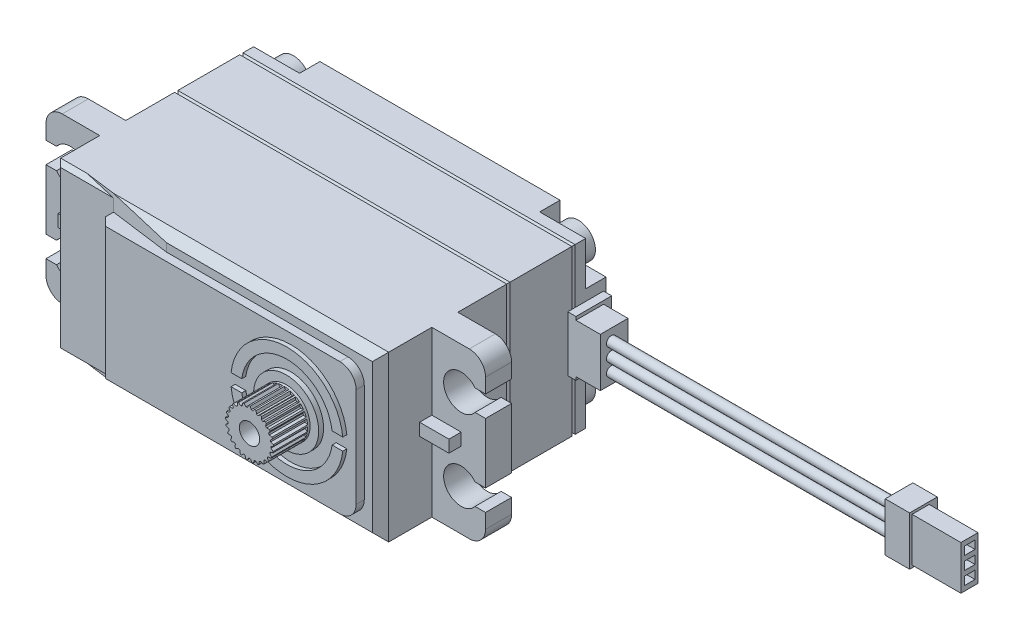
from build123d import *

# Parameters (mm, degrees)
SKETCH_1_W          = 40.8
SKETCH_1_H          = 20.2
EXTRUDE_1_DEPTH     = 4
CHAMFER_1_SIZE      = 0.2
SKETCH_2_W          = 40.8
SKETCH_2_H          = 20.2
EXTRUDE_2_DEPTH     = 8
CHAMFER_5_SIZE      = 0.2
SKETCH_3_W          = 40.8
SKETCH_3_H          = 20.2
EXTRUDE_3_DEPTH     = 15.7
CHAMFER_6_SIZE      = 0.2
CHAMFER_3_SIZE      = 1
CHAMFER_4_SIZE      = 0.2
SKETCH_4_R          = 6.9
EXTRUDE_4_DEPTH     = 1.5
SKETCH_5_R          = 4
EXTRUDE_5_DEPTH     = 0.1
SKETCH_6_R          = 2.95
EXTRUDE_6_DEPTH     = 4.5
SKETCH_7_R          = 1.25
CUT_EXTRUDE_1_DEPTH = 5
CUT_EXTRUDE_2_DEPTH = 4.2
EXTRUDE_7_DEPTH     = 3.2
FILLET_1_R          = 2
SKETCH_10_W         = 36.8
SKETCH_10_H         = 16.2
SKETCH_10_R         = 6.9
EXTRUDE_8_DEPTH     = 1
SKETCH_11_W         = 5
SKETCH_11_H         = 16.2
CUT_EXTRUDE_3_DEPTH = 1
FILLET_2_R          = 2
SKETCH_12_W         = 4.4
SKETCH_12_H         = 6.8
EXTRUDE_9_DEPTH     = 1
SKETCH_13_W         = 3.4
SKETCH_13_H         = 6
EXTRUDE_10_DEPTH    = 3
SKETCH_14_R         = 0.6
EXTRUDE_11_DEPTH    = 35
SKETCH_15_W         = 3.4
SKETCH_15_H         = 6
EXTRUDE_12_DEPTH    = 3
SKETCH_16_W         = 2.1
SKETCH_16_H         = 5.4
SKETCH_16_W_2       = 1.300246416
SKETCH_16_H_2       = 1
EXTRUDE_13_DEPTH    = 6
SKETCH_17_R         = 1
CUT_EXTRUDE_4_DEPTH = 2.5
SKETCH_18_R         = 1
CUT_EXTRUDE_5_DEPTH = 2.5
SKETCH_19_R         = 2.1
EXTRUDE_14_DEPTH    = 2
SKETCH_20_W         = 3.6
SKETCH_20_H         = 1.5
EXTRUDE_15_DEPTH    = 1.5
SKETCH_21_R         = 5.6
SKETCH_21_R_2       = 4
CUT_EXTRUDE_6_DEPTH = 0.5
CUT_EXTRUDE_7_DEPTH = 0.5
SKETCH_23_W         = 7
SKETCH_23_H         = 20.2
CUT_EXTRUDE_8_DEPTH = 1
CUT_EXTRUDE_9_DEPTH = 2
CHAMFER_7_SIZE      = 1
CHAMFER_9_SIZE      = 0.5


with BuildPart() as part:
    # 草图1 → 凸台-拉伸1 (new body)
    with BuildSketch(Plane.XY):
        Rectangle(SKETCH_1_W, SKETCH_1_H)
    extrude(amount=EXTRUDE_1_DEPTH)

    # 倒角1
    chamfer_1_edges = [part.edges().sort_by_distance(p)[0] for p in [
        (0, -10.1, 4),
        (20.4, 0, 4),
        (-20.4, 0, 4),
        (0, 10.1, 4),
    ]]
    chamfer(chamfer_1_edges, length=CHAMFER_1_SIZE)



with BuildPart() as body_2:
    # 草图2 → 凸台-拉伸2 (new body)
    with BuildSketch(Plane.XY.offset(4)):
        Rectangle(SKETCH_2_W, SKETCH_2_H)
    extrude(amount=EXTRUDE_2_DEPTH)

    # 倒角5
    chamfer_5_edges = [body_2.edges().sort_by_distance(p)[0] for p in [
        (0, -10.1, 12),
        (20.4, 0, 12),
        (-20.4, 0, 12),
        (0, 10.1, 12),
    ]]
    chamfer(chamfer_5_edges, length=CHAMFER_5_SIZE)

    # 倒角4
    chamfer_4_edges = [body_2.edges().sort_by_distance(p)[0] for p in [
        (0, 10.1, 4),
        (20.4, 0, 4),
        (0, -10.1, 4),
        (-20.4, 0, 4),
    ]]
    chamfer(chamfer_4_edges, length=CHAMFER_4_SIZE)


with BuildPart() as body_3:
    # 草图3 → 凸台-拉伸3 (new body)
    with BuildSketch(Plane.XY.offset(12)):
        Rectangle(SKETCH_3_W, SKETCH_3_H)
    extrude(amount=EXTRUDE_3_DEPTH)

    # 倒角6
    chamfer_6_edges = [body_3.edges().sort_by_distance(p)[0] for p in [
        (0, 10.1, 12),
        (20.4, 0, 12),
        (-20.4, 0, 12),
        (0, -10.1, 12),
    ]]
    chamfer(chamfer_6_edges, length=CHAMFER_6_SIZE)

    # 倒角3
    chamfer_3_edges = [body_3.edges().sort_by_distance(p)[0] for p in [
        (20.4, 0, 27.7),
        (0, -10.1, 27.7),
        (-20.4, 0, 27.7),
        (0, 10.1, 27.7),
    ]]
    chamfer(chamfer_3_edges, length=CHAMFER_3_SIZE)

    # 草图4 → 凸台-拉伸4 (add)
    with BuildSketch(Plane.XY.offset(27.7)):
        with Locations((10.4, 0)):
            Circle(SKETCH_4_R)
    extrude(amount=EXTRUDE_4_DEPTH)

    # 草图5 → 凸台-拉伸5 (add)
    with BuildSketch(Plane.XY.offset(29.2)):
        with Locations((10.4, 0)):
            Circle(SKETCH_5_R)
    extrude(amount=EXTRUDE_5_DEPTH)

    # 草图6 → 凸台-拉伸6 (add)
    with BuildSketch(Plane.XY.offset(29.3)):
        with Locations((10.4, 0)):
            Circle(SKETCH_6_R)
    extrude(amount=EXTRUDE_6_DEPTH)

    # 草图7 → 切除-拉伸1 (cut)
    with BuildSketch(Plane.XY.offset(33.8)):
        with Locations((10.4, 0)):
            Circle(SKETCH_7_R)
    extrude(amount=-CUT_EXTRUDE_1_DEPTH, mode=Mode.SUBTRACT)

    # 草图8 → 切除-拉伸2 (cut)
    with BuildSketch(Plane.XY.offset(33.8)):
        with BuildLine():
            Line((11.036355222, 2.880547176), (10.812882687, 2.613339954))
            ThreePointArc((10.812882687, 2.613339954), (10.718629565, 2.62690868), (10.623963172, 2.637206039))
            Line((10.623963172, 2.637206039), (10.475180758, 2.949041853))
            ThreePointArc((10.475180758, 2.949041853), (10.757412567, 2.928268474), (11.036355222, 2.880547176))
        make_face()
        with BuildLine():
            Line((10.3, 2.948304598), (10.15, 2.633916823))
            ThreePointArc((10.15, 2.633916823), (10.055333608, 2.623619464), (9.961080485, 2.610050738))
            Line((9.961080485, 2.610050738), (9.739421931, 2.875088975))
            ThreePointArc((9.739421931, 2.875088975), (10.017953037, 2.925156426), (10.3, 2.948304598))
        make_face()
        with BuildLine():
            Line((11.732725904, 2.631794381), (11.449822437, 2.428557325))
            ThreePointArc((11.449822437, 2.428557325), (11.361904854, 2.465139563), (11.27277343, 2.498655986))
            Line((11.27277343, 2.498655986), (11.206215702, 2.837695587))
            ThreePointArc((11.206215702, 2.837695587), (11.47441455, 2.747386645), (11.732725904, 2.631794381))
        make_face()
        with BuildLine():
            Line((12.345356517, 2.217676266), (12.020797982, 2.091179508))
            ThreePointArc((12.020797982, 2.091179508), (11.944740124, 2.148476661), (11.866744123, 2.203106188))
            Line((11.866744123, 2.203106188), (11.886593149, 2.54804647))
            ThreePointArc((11.886593149, 2.54804647), (12.123907116, 2.393876408), (12.345356517, 2.217676266))
        make_face()
        with BuildLine():
            Line((12.835753225, 1.664213396), (12.489932828, 1.622405191))
            ThreePointArc((12.489932828, 1.622405191), (12.430513691, 1.696817069), (12.368553888, 1.769127125))
            Line((12.368553888, 1.769127125), (12.47356248, 2.098294222))
            ThreePointArc((12.47356248, 2.098294222), (12.665080258, 1.889950112), (12.835753225, 1.664213396))
        make_face()
        with BuildLine():
            Line((13.1731026, 1.006181877), (12.827749509, 1.051689189))
            ThreePointArc((12.827749509, 1.051689189), (12.788702615, 1.13854022), (12.746672173, 1.223987299))
            Line((12.746672173, 1.223987299), (12.930242255, 1.516698431))
            ThreePointArc((12.930242255, 1.516698431), (13.063930076, 1.2672713), (13.1731026, 1.006181877))
        make_face()
        with BuildLine():
            Line((13.33620774, 0.28492825), (13.01302176, 0.414891688))
            ThreePointArc((13.01302176, 0.414891688), (12.996800569, 0.508724701), (12.977340415, 0.601939849))
            Line((12.977340415, 0.601939849), (13.227937603, 0.8398029))
            ThreePointArc((13.227937603, 0.8398029), (13.295395371, 0.564965172), (13.33620774, 0.28492825))
        make_face()
        with BuildLine():
            Line((13.314820149, -0.454228466), (13.034108243, -0.247974984))
            ThreePointArc((13.034108243, -0.247974984), (13.041731992, -0.153055861), (13.04606488, -0.057929695))
            Line((13.04606488, -0.057929695), (13.347943232, 0.110139464))
            ThreePointArc((13.347943232, 0.110139464), (13.344932326, -0.172839796), (13.314820149, -0.454228466))
        make_face()
        with BuildLine():
            Line((13.110283688, -1.164844338), (12.889684018, -0.895260476))
            ThreePointArc((12.889684018, -0.895260476), (12.920673679, -0.805219361), (12.948527356, -0.714159303))
            Line((12.948527356, -0.714159303), (13.282718745, -0.626444439))
            ThreePointArc((13.282718745, -0.626444439), (13.209428352, -0.899784604), (13.110283688, -1.164844338))
        make_face()
        with BuildLine():
            Line((12.735450135, -1.802268755), (12.58882379, -1.486293459))
            ThreePointArc((12.58882379, -1.486293459), (12.641232168, -1.406787967), (12.690856486, -1.325515656))
            Line((12.690856486, -1.325515656), (13.036362438, -1.323666535))
            ThreePointArc((13.036362438, -1.323666535), (12.897397663, -1.570192636), (12.735450135, -1.802268755))
        make_face()
        with BuildLine():
            Line((12.213871661, -2.326449999), (12.150431713, -1.983937159))
            ThreePointArc((12.150431713, -1.983937159), (12.220965797, -1.919962911), (12.289242678, -1.853584986))
            Line((12.289242678, -1.853584986), (12.624353783, -1.937717794))
            ThreePointArc((12.624353783, -1.937717794), (12.428446294, -2.14193969), (12.213871661, -2.326449999))
        make_face()
        with BuildLine():
            Line((11.57832096, -2.704451833), (11.602053574, -2.35692279))
            ThreePointArc((11.602053574, -2.35692279), (11.686281449, -2.312499524), (11.768920805, -2.265186753))
            Line((11.768920805, -2.265186753), (12.072580799, -2.430015117))
            ThreePointArc((12.072580799, -2.430015117), (11.832040183, -2.579100795), (11.57832096, -2.704451833))
        make_face()
        with BuildLine():
            Line((10.868732019, -2.912523012), (10.978145988, -2.581814294))
            ThreePointArc((10.978145988, -2.581814294), (11.070775306, -2.559733288), (11.162584602, -2.534458507))
            Line((11.162584602, -2.534458507), (11.415713412, -2.769625654))
            ThreePointArc((11.415713412, -2.769625654), (11.145653722, -2.854207513), (10.868732019, -2.912523012))
        make_face()
        with BuildLine():
            Line((10.129690921, -2.937589659), (10.317911363, -2.644480911))
            ThreePointArc((10.317911363, -2.644480911), (10.413121884, -2.646129595), (10.508332405, -2.644480911))
            Line((10.508332405, -2.644480911), (10.695025016, -2.935210425))
            ThreePointArc((10.695025016, -2.935210425), (10.412415095, -2.949973875), (10.129690921, -2.937589659))
        make_face()
        with BuildLine():
            Line((9.407634337, -2.778076743), (9.662834669, -2.540985066))
            ThreePointArc((9.662834669, -2.540985066), (9.754643965, -2.566259847), (9.847273284, -2.588340853))
            Line((9.847273284, -2.588340853), (9.955799113, -2.91636513))
            ThreePointArc((9.955799113, -2.91636513), (9.678396382, -2.86038253), (9.407634337, -2.778076743))
        make_face()
        with BuildLine():
            Line((8.747931738, -2.444007049), (9.054076784, -2.277829785))
            ThreePointArc((9.054076784, -2.277829785), (9.13671614, -2.325142556), (9.220944015, -2.369565821))
            Line((9.220944015, -2.369565821), (9.244483986, -2.714273888))
            ThreePointArc((9.244483986, -2.714273888), (8.989718678, -2.59106283), (8.747931738, -2.444007049))
        make_face()
        with BuildLine():
            Line((8.192034663, -1.956371404), (8.529888205, -1.871550081))
            ThreePointArc((8.529888205, -1.871550081), (8.598165086, -1.937928006), (8.66869917, -2.001902254))
            Line((8.66869917, -2.001902254), (8.605774179, -2.341634836))
            ThreePointArc((8.605774179, -2.341634836), (8.389654136, -2.158937124), (8.192034663, -1.956371404))
        make_face()
        with BuildLine():
            Line((7.77487217, -1.345809748), (8.123205627, -1.347674002))
            ThreePointArc((8.123205627, -1.347674002), (8.172829946, -1.428946313), (8.225238324, -1.508451805))
            Line((8.225238324, -1.508451805), (8.07980218, -1.821862254))
            ThreePointArc((8.07980218, -1.821862254), (7.915907018, -1.591157458), (7.77487217, -1.345809748))
        make_face()
        with BuildLine():
            Line((7.522656114, -0.650685916), (7.859582414, -0.73911861))
            ThreePointArc((7.859582414, -0.73911861), (7.887436091, -0.830178667), (7.918425752, -0.920219782))
            Line((7.918425752, -0.920219782), (7.699616742, -1.187615367))
            ThreePointArc((7.699616742, -1.187615367), (7.598244598, -0.923399517), (7.522656114, -0.650685916))
        make_face()
        with BuildLine():
            Line((7.451234156, 0.085322905), (7.75558298, -0.084121676))
            ThreePointArc((7.75558298, -0.084121676), (7.759915868, -0.179247843), (7.767539616, -0.274166966))
            Line((7.767539616, -0.274166966), (7.489106316, -0.478746239))
            ThreePointArc((7.489106316, -0.478746239), (7.456626774, -0.197620989), (7.451234156, 0.085322905))
        make_face()
        with BuildLine():
            Line((7.565094001, 0.815970574), (7.817741993, 0.576160931))
            ThreePointArc((7.817741993, 0.576160931), (7.79828184, 0.482945783), (7.782060648, 0.38911277))
            Line((7.782060648, 0.38911277), (7.461498046, 0.260204276))
            ThreePointArc((7.461498046, 0.260204276), (7.499951915, 0.540574793), (7.565094001, 0.815970574))
        make_face()
        with BuildLine():
            Line((7.857081416, 1.495347811), (8.042153774, 1.200241228))
            ThreePointArc((8.042153774, 1.200241228), (8.000123332, 1.114794149), (7.961076438, 1.027943118))
            Line((7.961076438, 1.027943118), (7.61852666, 0.9828052))
            ThreePointArc((7.61852666, 0.9828052), (7.725497743, 1.244804273), (7.857081416, 1.495347811))
        make_face()
        with BuildLine():
            Line((8.308849758, 2.080766845), (8.414717705, 1.748905955))
            ThreePointArc((8.414717705, 1.748905955), (8.352757902, 1.676595898), (8.293338765, 1.602184021))
            Line((8.293338765, 1.602184021), (7.950325474, 1.643652858))
            ThreePointArc((7.950325474, 1.643652858), (8.119092384, 1.870818122), (8.308849758, 2.080766845))
        make_face()
        with BuildLine():
            Line((8.89201276, 2.535443646), (8.912024223, 2.187680488))
            ThreePointArc((8.912024223, 2.187680488), (8.834028222, 2.133050962), (8.757970364, 2.075753808))
            Line((8.757970364, 2.075753808), (8.436046348, 2.201223763))
            ThreePointArc((8.436046348, 2.201223763), (8.656004839, 2.379281589), (8.89201276, 2.535443646))
        make_face()
        with BuildLine():
            Line((9.569928146, 2.830809198), (9.502825732, 2.488995011))
            ThreePointArc((9.502825732, 2.488995011), (9.413694308, 2.455478588), (9.325776725, 2.41889635))
            Line((9.325776725, 2.41889635), (9.045169653, 2.620483682))
            ThreePointArc((9.045169653, 2.620483682), (9.302498923, 2.738246042), (9.569928146, 2.830809198))
        make_face()
    extrude(amount=-CUT_EXTRUDE_2_DEPTH, mode=Mode.SUBTRACT)

    # 草图9 → 凸台-拉伸7 (add)
    with BuildSketch(Plane.XY.offset(18.2)):
        with BuildLine():
            Line((20.4, -10.1), (27, -10.1))
            Line((27, -10.1), (27, -6.3))
            Line((27, -6.3), (25.712454379, -6.3))
            ThreePointArc((25.712454379, -6.3), (21.85, -5), (25.712454379, -3.7))
            Line((25.712454379, -3.7), (27, -3.7))
            Line((27, -3.7), (27, 3.7))
            Line((27, 3.7), (25.712454379, 3.7))
            ThreePointArc((25.712454379, 3.7), (21.85, 5), (25.712454379, 6.3))
            Line((25.712454379, 6.3), (27, 6.3))
            Line((27, 6.3), (27, 10.1))
            Line((27, 10.1), (20.4, 10.1))
            Line((20.4, 10.1), (20.4, -10.1))
        make_face()
        with BuildLine():
            Line((-27, 10.1), (-27, 6.3))
            Line((-27, 6.3), (-25.712454379, 6.3))
            ThreePointArc((-25.712454379, 6.3), (-21.85, 5), (-25.712454379, 3.7))
            Line((-25.712454379, 3.7), (-27, 3.7))
            Line((-27, 3.7), (-27, -3.7))
            Line((-27, -3.7), (-25.712454379, -3.7))
            ThreePointArc((-25.712454379, -3.7), (-21.85, -5), (-25.712454379, -6.3))
            Line((-25.712454379, -6.3), (-27, -6.3))
            Line((-27, -6.3), (-27, -10.1))
            Line((-27, -10.1), (-20.4, -10.1))
            Line((-20.4, -10.1), (-20.4, 10.1))
            Line((-20.4, 10.1), (-27, 10.1))
        make_face()
    extrude(amount=EXTRUDE_7_DEPTH)

    # 圆角1
    fillet_1_edges = [body_3.edges().sort_by_distance(p)[0] for p in [
        (27, 10.1, 19.8),
        (27, -10.1, 19.8),
        (-27, -10.1, 19.8),
        (-27, 10.1, 19.8),
    ]]
    fillet(fillet_1_edges, radius=FILLET_1_R)

    # 草图10 → 凸台-拉伸8 (add)
    with BuildSketch(Plane.XY.offset(27.7)):
        Rectangle(SKETCH_10_W, SKETCH_10_H)
        with Locations((10.4, 0)):
            Circle(SKETCH_10_R, mode=Mode.SUBTRACT)
    extrude(amount=EXTRUDE_8_DEPTH)

    # 草图11 → 切除-拉伸3 (cut)
    with BuildSketch(Plane.XY.offset(28.7)):
        with Locations((-15.9, 0)):
            Rectangle(SKETCH_11_W, SKETCH_11_H)
    extrude(amount=-CUT_EXTRUDE_3_DEPTH, mode=Mode.SUBTRACT)

    # 圆角2
    fillet_2_edges = [body_3.edges().sort_by_distance(p)[0] for p in [
        (18.4, 8.1, 28.2),
        (18.4, -8.1, 28.2),
    ]]
    fillet(fillet_2_edges, radius=FILLET_2_R)

    # 草图20 → 凸台-拉伸15 (add)
    with BuildSketch(Plane.XY.offset(21.4)):
        with Locations((-22.2, 0)):
            Rectangle(SKETCH_20_W, SKETCH_20_H)
        with Locations((22.2, 0)):
            Rectangle(SKETCH_20_W, SKETCH_20_H)
    extrude(amount=EXTRUDE_15_DEPTH)

    # 草图21 → 切除-拉伸6 (cut)
    with BuildSketch(Plane.XY.offset(29.2)):
        with Locations((10.4, 0)):
            Circle(SKETCH_21_R)
        with Locations((10.4, 0)):
            Circle(SKETCH_21_R_2, mode=Mode.SUBTRACT)
    extrude(amount=-CUT_EXTRUDE_6_DEPTH, mode=Mode.SUBTRACT)

    # 草图22 → 切除-拉伸7 (cut)
    with BuildSketch(Plane.XY.offset(29.2)):
        with BuildLine():
            Line((3.540881981, -0.75), (4.850450469, -0.75))
            ThreePointArc((4.850450469, -0.75), (4.8, 0), (4.850450469, 0.75))
            Line((4.850450469, 0.75), (3.540881981, 0.75))
            ThreePointArc((3.540881981, 0.75), (3.5, 0), (3.540881981, -0.75))
        make_face()
        with BuildLine():
            Line((15.949549531, -0.75), (17.259118019, -0.75))
            ThreePointArc((17.259118019, -0.75), (17.3, 0), (17.259118019, 0.75))
            Line((17.259118019, 0.75), (15.949549531, 0.75))
            ThreePointArc((15.949549531, 0.75), (16, 0), (15.949549531, -0.75))
        make_face()
    extrude(amount=-CUT_EXTRUDE_7_DEPTH, mode=Mode.SUBTRACT)

    # 草图23 → 切除-拉伸8 (cut)
    with BuildSketch(Plane.XY.offset(27.7)):
        with Locations((-16.9, 0)):
            Rectangle(SKETCH_23_W, SKETCH_23_H)
    extrude(amount=-CUT_EXTRUDE_8_DEPTH, mode=Mode.SUBTRACT)

    # 草图24 → 切除-拉伸9 (cut)
    with BuildSketch(Plane.XZ.offset(10.1)):
        Polygon((-13.4, 26.7), (-5.9, 27.7), (-13.4, 27.7), align=None)
    cut_extrude_9 = extrude(amount=-CUT_EXTRUDE_9_DEPTH, mode=Mode.SUBTRACT)

    # 镜向2: 切除-拉伸9 across plane
    add(cut_extrude_9.mirror(Plane.ZX), mode=Mode.SUBTRACT)

    # 倒角7
    chamfer_7_edges = [body_3.edges().sort_by_distance(p)[0] for p in [
        (-13.4, 0, 28.7),
    ]]
    chamfer(chamfer_7_edges, length=CHAMFER_7_SIZE)

    # 倒角9
    chamfer_9_edges = [body_3.edges().sort_by_distance(p)[0] for p in [
        (-16.9, 10.1, 26.7),
        (-20.4, 0, 26.7),
        (-16.9, -10.1, 26.7),
    ]]
    chamfer(chamfer_9_edges, length=CHAMFER_9_SIZE)


with BuildPart() as part_1:
    add(part.part)

    add(body_2.part)  # 凸台-拉伸9 merges body 2
    # 草图12 → 凸台-拉伸9 (add)
    with BuildSketch(Plane(origin=(20.4, 0, 0), x_dir=(0, 0, -1), z_dir=(1, 0, 0))):
        with Locations((-2.5, 0)):
            Rectangle(SKETCH_12_W, SKETCH_12_H)
    extrude(amount=EXTRUDE_9_DEPTH)

    # 草图13 → 凸台-拉伸10 (add)
    with BuildSketch(Plane(origin=(21.4, 0, 0), x_dir=(0, 0, -1), z_dir=(1, 0, 0))):
        with Locations((-3, 0)):
            Rectangle(SKETCH_13_W, SKETCH_13_H)
    extrude(amount=EXTRUDE_10_DEPTH)

    # 草图14 → 凸台-拉伸11 (add)
    with BuildSketch(Plane(origin=(24.4, 0, 0), x_dir=(0, 0, -1), z_dir=(1, 0, 0))):
        with Locations((-3.35, 1.6)):
            Circle(SKETCH_14_R)
        with Locations((-3.35, 0)):
            Circle(SKETCH_14_R)
        with Locations((-3.35, -1.6)):
            Circle(SKETCH_14_R)
    extrude(amount=EXTRUDE_11_DEPTH)

    # 草图15 → 凸台-拉伸12 (add)
    with BuildSketch(Plane(origin=(59.4, 0, 0), x_dir=(0, 0, -1), z_dir=(1, 0, 0))):
        with Locations((-3, 0)):
            Rectangle(SKETCH_15_W, SKETCH_15_H)
    extrude(amount=EXTRUDE_12_DEPTH)

    # 草图16 → 凸台-拉伸13 (add)
    with BuildSketch(Plane(origin=(62.4, 0, 0), x_dir=(0, 0, -1), z_dir=(1, 0, 0))):
        with Locations((-3.35, 0)):
            Rectangle(SKETCH_16_W, SKETCH_16_H)
        with Locations((-3.316419984, 1.6)):
            Rectangle(SKETCH_16_W_2, SKETCH_16_H_2, mode=Mode.SUBTRACT)
        with Locations((-3.316419984, 0)):
            Rectangle(SKETCH_16_W_2, SKETCH_16_H_2, mode=Mode.SUBTRACT)
        with Locations((-3.316419984, -1.6)):
            Rectangle(SKETCH_16_W_2, SKETCH_16_H_2, mode=Mode.SUBTRACT)
    extrude(amount=EXTRUDE_13_DEPTH)

    # 草图17 → 切除-拉伸4 (cut)
    # profile 1 of 4: a face of its own
    with BuildSketch(Plane(origin=(0, 0, 0), x_dir=(-1, 0, 0), z_dir=(0, 0, -1))):
        with BuildLine():
            Line((-14.75, 7.5), (-14.75, 10.1))
            Line((-14.75, 10.1), (-20.4, 10.1))
            Line((-20.4, 10.1), (-20.4, 4.75))
            Line((-20.4, 4.75), (-17.5, 4.75))
            ThreePointArc((-17.5, 4.75), (-15.555456352, 5.555456352), (-14.75, 7.5))
        make_face()
        with Locations((-17.5, 7.5)):
            Circle(SKETCH_17_R, mode=Mode.SUBTRACT)
    # profile 2 of 4: a face of its own
    with BuildSketch(Plane(origin=(0, 0, 0), x_dir=(-1, 0, 0), z_dir=(0, 0, -1))):
        with BuildLine():
            Line((-17.5, -4.75), (-20.4, -4.75))
            Line((-20.4, -4.75), (-20.4, -10.1))
            Line((-20.4, -10.1), (-14.75, -10.1))
            Line((-14.75, -10.1), (-14.75, -7.5))
            ThreePointArc((-14.75, -7.5), (-15.555456352, -5.555456352), (-17.5, -4.75))
        make_face()
        with Locations((-17.5, -7.5)):
            Circle(SKETCH_17_R, mode=Mode.SUBTRACT)
    # profile 3 of 4: a face of its own
    with BuildSketch(Plane(origin=(0, 0, 0), x_dir=(-1, 0, 0), z_dir=(0, 0, -1))):
        with BuildLine():
            Line((17.5, -4.75), (20.4, -4.75))
            Line((20.4, -4.75), (20.4, -10.1))
            Line((20.4, -10.1), (14.75, -10.1))
            Line((14.75, -10.1), (14.75, -7.5))
            ThreePointArc((14.75, -7.5), (15.555456352, -5.555456352), (17.5, -4.75))
        make_face()
        with Locations((17.5, -7.5)):
            Circle(SKETCH_17_R, mode=Mode.SUBTRACT)
    # profile 4 of 4: a face of its own
    with BuildSketch(Plane(origin=(0, 0, 0), x_dir=(-1, 0, 0), z_dir=(0, 0, -1))):
        with BuildLine():
            Line((14.75, 7.5), (14.75, 10.1))
            Line((14.75, 10.1), (20.4, 10.1))
            Line((20.4, 10.1), (20.4, 4.75))
            Line((20.4, 4.75), (17.5, 4.75))
            ThreePointArc((17.5, 4.75), (15.555456352, 5.555456352), (14.75, 7.5))
        make_face()
        with Locations((17.5, 7.5)):
            Circle(SKETCH_17_R, mode=Mode.SUBTRACT)
    extrude(amount=-CUT_EXTRUDE_4_DEPTH, mode=Mode.SUBTRACT)

    # 草图18 → 切除-拉伸5 (cut)
    with BuildSketch(Plane(origin=(0, 0, 0), x_dir=(-1, 0, 0), z_dir=(0, 0, -1))):
        with Locations((-17.5, -7.5)):
            Circle(SKETCH_18_R)
        with Locations((-17.5, 7.5)):
            Circle(SKETCH_18_R)
        with Locations((17.5, 7.5)):
            Circle(SKETCH_18_R)
        with Locations((17.5, -7.5)):
            Circle(SKETCH_18_R)
    extrude(amount=-CUT_EXTRUDE_5_DEPTH, mode=Mode.SUBTRACT)

    # 草图19 → 凸台-拉伸14 (add)
    # profile 1 of 4: a face of its own
    with BuildSketch(Plane(origin=(0, 0, 2.5), x_dir=(-1, 0, 0), z_dir=(0, 0, -1))):
        with Locations((-17.5, 7.5)):
            Circle(SKETCH_19_R)
        with BuildLine():
            Line((-18, 7), (-18, 5.822949017))
            ThreePointArc((-18, 5.822949017), (-17.5, 5.75), (-17, 5.822949017))
            Line((-17, 5.822949017), (-17, 7))
            Line((-17, 7), (-15.822949017, 7))
            ThreePointArc((-15.822949017, 7), (-15.75, 7.5), (-15.822949017, 8))
            Line((-15.822949017, 8), (-17, 8))
            Line((-17, 8), (-17, 9.177050983))
            ThreePointArc((-17, 9.177050983), (-17.5, 9.25), (-18, 9.177050983))
            Line((-18, 9.177050983), (-18, 8))
            Line((-18, 8), (-19.177050983, 8))
            ThreePointArc((-19.177050983, 8), (-19.25, 7.5), (-19.177050983, 7))
            Line((-19.177050983, 7), (-18, 7))
        make_face(mode=Mode.SUBTRACT)
    # profile 2 of 4: a face of its own
    with BuildSketch(Plane(origin=(0, 0, 2.5), x_dir=(-1, 0, 0), z_dir=(0, 0, -1))):
        with Locations((-17.5, -7.5)):
            Circle(SKETCH_19_R)
        with BuildLine():
            Line((-17, -7), (-15.822949017, -7))
            ThreePointArc((-15.822949017, -7), (-15.75, -7.5), (-15.822949017, -8))
            Line((-15.822949017, -8), (-17, -8))
            Line((-17, -8), (-17, -9.177050983))
            ThreePointArc((-17, -9.177050983), (-17.5, -9.25), (-18, -9.177050983))
            Line((-18, -9.177050983), (-18, -8))
            Line((-18, -8), (-19.177050983, -8))
            ThreePointArc((-19.177050983, -8), (-19.25, -7.5), (-19.177050983, -7))
            Line((-19.177050983, -7), (-18, -7))
            Line((-18, -7), (-18, -5.822949017))
            ThreePointArc((-18, -5.822949017), (-17.5, -5.75), (-17, -5.822949017))
            Line((-17, -5.822949017), (-17, -7))
        make_face(mode=Mode.SUBTRACT)
    # profile 3 of 4: a face of its own
    with BuildSketch(Plane(origin=(0, 0, 2.5), x_dir=(-1, 0, 0), z_dir=(0, 0, -1))):
        with Locations((17.5, 7.5)):
            Circle(SKETCH_19_R)
        with BuildLine():
            Line((17, 8), (15.822949017, 8))
            ThreePointArc((15.822949017, 8), (15.75, 7.5), (15.822949017, 7))
            Line((15.822949017, 7), (17, 7))
            Line((17, 7), (17, 5.822949017))
            ThreePointArc((17, 5.822949017), (17.5, 5.75), (18, 5.822949017))
            Line((18, 5.822949017), (18, 7))
            Line((18, 7), (19.177050983, 7))
            ThreePointArc((19.177050983, 7), (19.25, 7.5), (19.177050983, 8))
            Line((19.177050983, 8), (18, 8))
            Line((18, 8), (18, 9.177050983))
            ThreePointArc((18, 9.177050983), (17.5, 9.25), (17, 9.177050983))
            Line((17, 9.177050983), (17, 8))
        make_face(mode=Mode.SUBTRACT)
    # profile 4 of 4: a face of its own
    with BuildSketch(Plane(origin=(0, 0, 2.5), x_dir=(-1, 0, 0), z_dir=(0, 0, -1))):
        with Locations((17.5, -7.5)):
            Circle(SKETCH_19_R)
        with BuildLine():
            Line((17, -8), (15.822949017, -8))
            ThreePointArc((15.822949017, -8), (15.75, -7.5), (15.822949017, -7))
            Line((15.822949017, -7), (17, -7))
            Line((17, -7), (17, -5.822949017))
            ThreePointArc((17, -5.822949017), (17.5, -5.75), (18, -5.822949017))
            Line((18, -5.822949017), (18, -7))
            Line((18, -7), (19.177050983, -7))
            ThreePointArc((19.177050983, -7), (19.25, -7.5), (19.177050983, -8))
            Line((19.177050983, -8), (18, -8))
            Line((18, -8), (18, -9.177050983))
            ThreePointArc((18, -9.177050983), (17.5, -9.25), (17, -9.177050983))
            Line((17, -9.177050983), (17, -8))
        make_face(mode=Mode.SUBTRACT)
    extrude(amount=EXTRUDE_14_DEPTH)


solid = Compound([body_3.part, part_1.part])
